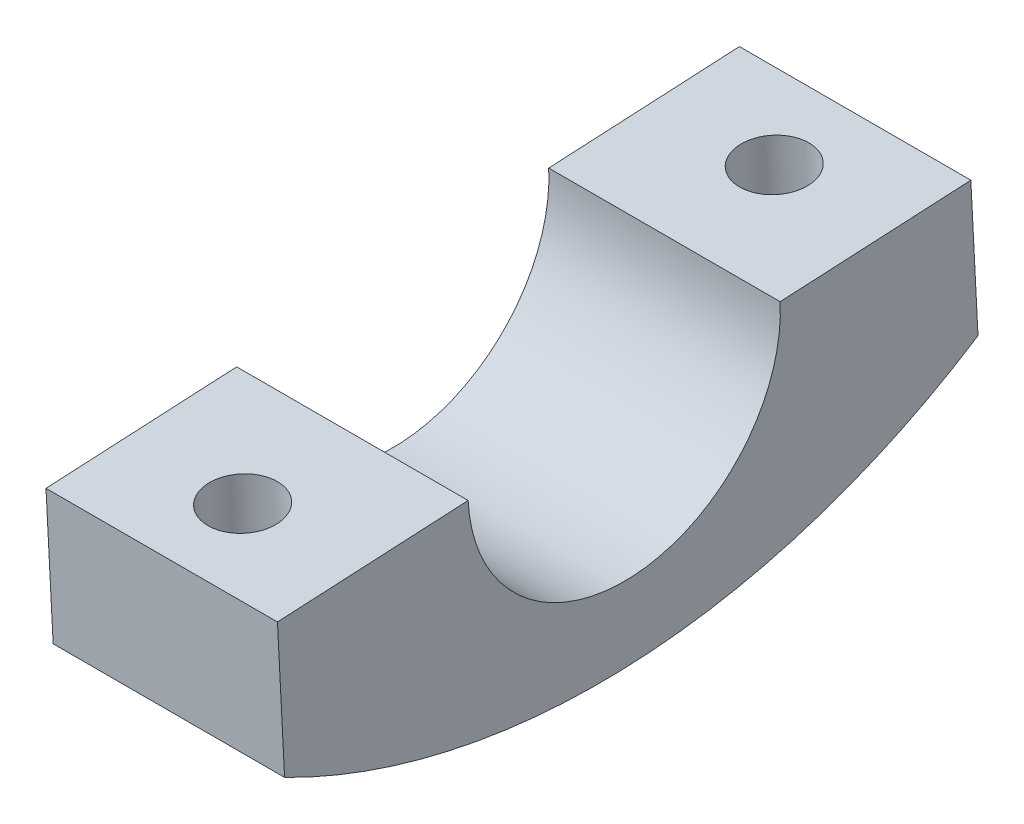
from build123d import *

# Parameters (mm, degrees)
EXTRUDE_1_DEPTH     = 20
SKETCH_3_R          = 14
CUT_EXTRUDE_1_DEPTH = 20
SKETCH_4_R          = 3
CUT_EXTRUDE_2_DEPTH = 22.516585743
EXTRUDE_2_DEPTH     = 20
SKETCH_7_R          = 13.5
CUT_EXTRUDE_3_DEPTH = 28
SKETCH_8_R          = 3
CUT_EXTRUDE_4_DEPTH = 20
SKETCH_9_R          = 7.5
SKETCH_9_R_2        = 3
CUT_EXTRUDE_5_DEPTH = 20


# Read off the part's stored shape, not the designer's step: 填料-伸長1
with BuildPart() as part:
    # 填料-伸長1 outline → 填料-伸長1 (new body)
    with BuildSketch(Plane(origin=(0, 0, 0), x_dir=(0, 0, -1), z_dir=(1, 0, 0))):
        Polygon((-4019.675958787, 200.25160655), (-4018.512862627, 177.765080788), (-3958.59296353, 180.864385914), (-3959.75605969, 203.350911676), align=None)
    extrude(amount=EXTRUDE_1_DEPTH)

    # 草圖3 → 除料-伸長1 (cut)
    with BuildSketch(Plane.ZY):
        with Locations((3988.552913079, 179.314733351)):
            Circle(SKETCH_3_R)
    extrude(amount=-CUT_EXTRUDE_1_DEPTH, mode=Mode.SUBTRACT)

    # 草圖4 → 除料-伸長2 (cut)
    with BuildSketch(Plane(origin=(0, 407.076792548, 21.055696166), x_dir=(1, 0, 0), z_dir=(0, 0.9986649849421085, 0.051655085428040495))):
        with Locations(Location((10, -3950.965617011, 0), (0, 0, 270))):
            Circle(SKETCH_4_R)
    cut_extrude_2 = extrude(amount=-CUT_EXTRUDE_2_DEPTH, mode=Mode.SUBTRACT)

    # 鏡射1: 除料-伸長2 across plane
    add(cut_extrude_2.mirror(Plane(origin=(0, -205.275533435, 3968.660313072), x_dir=(1, 0, 0), z_dir=(0, 0.05165508542804326, -0.9986649849421085))), mode=Mode.SUBTRACT)


with BuildPart() as body_2:
    # 草圖6 → 填料-伸長2 (new body)
    with BuildSketch(Plane(origin=(0, 0, 0), x_dir=(0, 0, -1), z_dir=(1, 0, 0))):
        with BuildLine():
            Line((-4017.894989071, 165.819525376), (-4018.512862627, 177.765080788))
            Line((-4018.512862627, 177.765080788), (-3958.59296353, 180.864385914))
            Line((-3958.59296353, 180.864385914), (-3957.975089975, 168.918830502))
            ThreePointArc((-3957.975089975, 168.918830502), (-3987.51981137, 159.341433652), (-4017.894989071, 165.819525376))
        make_face()
    extrude(amount=EXTRUDE_2_DEPTH)

    # 草圖7 → 除料-伸長3 (cut)
    with BuildSketch(Plane.ZY):
        with Locations((3988.552913079, 179.314733351)):
            Circle(SKETCH_7_R)
    extrude(amount=-CUT_EXTRUDE_3_DEPTH, mode=Mode.SUBTRACT)

    # 草圖8 → 除料-伸長4 (cut)
    with BuildSketch(Plane(origin=(0, 384.590266786, 19.892600006), x_dir=(1, 0, 0), z_dir=(0, 0.9986649849421085, 0.05165508542804074))):
        with Locations(Location((10, -3996.965617011, 0), (0, 0, 270))):
            Circle(SKETCH_8_R)
    cut_extrude_4 = extrude(amount=-CUT_EXTRUDE_4_DEPTH, mode=Mode.SUBTRACT)

    # 草圖9 → 除料-伸長5 (cut)
    with BuildSketch(Plane(origin=(0, 372.644711374, 19.27472645), x_dir=(1, 0, 0), z_dir=(0, 0.9986649849421085, 0.05165508542804074))):
        with Locations((10, -3996.965617011)):
            Circle(SKETCH_9_R)
        with Locations(Location((10, -3996.965617011, 0), (0, 0, 270))):
            Circle(SKETCH_9_R_2, mode=Mode.SUBTRACT)
    cut_extrude_5 = extrude(amount=-CUT_EXTRUDE_5_DEPTH, mode=Mode.SUBTRACT)

    # 鏡射4: 除料-伸長4, 除料-伸長5 across plane
    add(cut_extrude_4.mirror(Plane(origin=(0, -205.275533435, 3968.660313072), x_dir=(1, 0, 0), z_dir=(0, 0.05165508542804326, -0.9986649849421085))), mode=Mode.SUBTRACT)
    add(cut_extrude_5.mirror(Plane(origin=(0, -205.275533435, 3968.660313072), x_dir=(1, 0, 0), z_dir=(0, 0.05165508542804326, -0.9986649849421085))), mode=Mode.SUBTRACT)


solid = body_2.part
